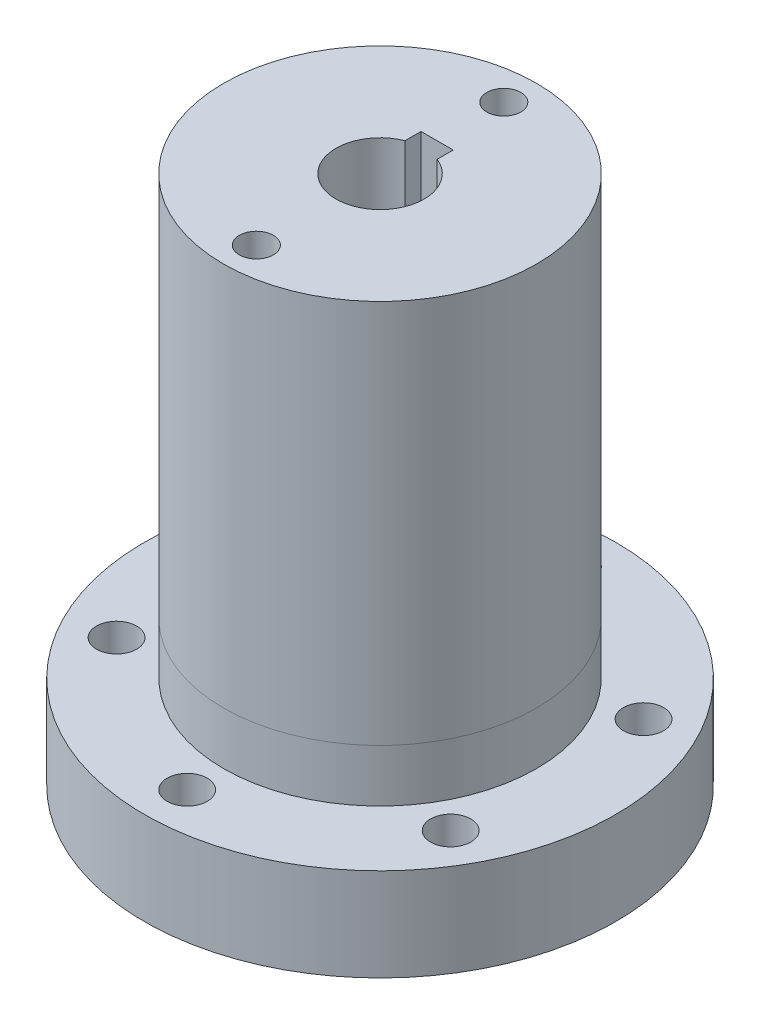
from build123d import *

# Parameters (mm, degrees)
SKETCH1_R           = 25.28
BOSS_EXTRUDE1_DEPTH = 8.5
SKETCH2_R           = 25.3
BOSS_EXTRUDE2_DEPTH = 57.15
SKETCH7_R           = 25.3
BOSS_EXTRUDE4_DEPTH = 15
CUT_EXTRUDE3_DEPTH  = 115
SKETCH6_R           = 38.1
BOSS_EXTRUDE3_DEPTH = 15
SKETCH9_R           = 3.25
CUT_EXTRUDE4_DEPTH  = 20
SKETCH10_R          = 2.75
CUT_EXTRUDE6_DEPTH  = 129
BOSS_EXTRUDE5_START = -93
BOSS_EXTRUDE5_DEPTH = 93
CUT_EXTRUDE8_START  = -10
SKETCH12_R          = 25.3
CUT_EXTRUDE8_DEPTH  = 10
CUT_EXTRUDE9_DEPTH  = 30


with BuildPart() as part:
    # Sketch1 → Boss-Extrude1 (new body)
    with BuildSketch(Plane(origin=(0, 0, 0), x_dir=(1, 0, 0), z_dir=(0, 1, 0))):
        Circle(SKETCH1_R)
    extrude(amount=BOSS_EXTRUDE1_DEPTH)

    # Sketch2 → Boss-Extrude2 (add)
    with BuildSketch(Plane(origin=(0, 8.5, 0), x_dir=(1, 0, 0), z_dir=(0, 1, 0))):
        Circle(SKETCH2_R)
    extrude(amount=BOSS_EXTRUDE2_DEPTH)

    # Sketch7 → Boss-Extrude4 (add)
    with BuildSketch(Plane(origin=(0, 65.65, 0), x_dir=(1, 0, 0), z_dir=(0, 1, 0))):
        Circle(SKETCH7_R)
    extrude(amount=BOSS_EXTRUDE4_DEPTH)

    # Sketch5 → Cut-Extrude3 (cut)
    with BuildSketch(Plane.XZ):
        with BuildLine():
            Line((2.575, 9.15), (-2.575, 9.15))
            Line((-2.575, 9.15), (-2.575, 6.777305881))
            ThreePointArc((-2.575, 6.777305881), (0, -7.25), (2.575, 6.777305881))
            Line((2.575, 6.777305881), (2.575, 9.15))
        make_face()
    extrude(amount=-CUT_EXTRUDE3_DEPTH, mode=Mode.SUBTRACT)

    # Sketch6 → Boss-Extrude3 (add)
    with BuildSketch(Plane.XZ):
        Circle(SKETCH6_R)
    extrude(amount=BOSS_EXTRUDE3_DEPTH)

    # Sketch9 → Cut-Extrude4 (cut)
    with BuildSketch(Plane(origin=(0, 0, 0), x_dir=(1, 0, 0), z_dir=(0, 1, 0))):
        with Locations((0, 31.176914536)):
            Circle(SKETCH9_R)
        with Locations((-27, 15.588457268)):
            Circle(SKETCH9_R)
        with Locations((27, 15.588457268)):
            Circle(SKETCH9_R)
        with Locations((-27, -15.588457268)):
            Circle(SKETCH9_R)
        with Locations((27, -15.588457268)):
            Circle(SKETCH9_R)
        with Locations((0, -31.176914536)):
            Circle(SKETCH9_R)
    extrude(amount=-CUT_EXTRUDE4_DEPTH, mode=Mode.SUBTRACT)

    # Sketch10 → Cut-Extrude6 (cut)
    with BuildSketch(Plane(origin=(0, 80.65, 0), x_dir=(1, 0, 0), z_dir=(0, 1, 0))):
        with Locations((0, 20)):
            Circle(SKETCH10_R)
        with Locations((0, -20)):
            Circle(SKETCH10_R)
    extrude(amount=-CUT_EXTRUDE6_DEPTH, mode=Mode.SUBTRACT)

    # Sketch11 → Boss-Extrude5 (add)
    with BuildSketch(Plane(origin=(0, 80.65, 0), x_dir=(1, 0, 0), z_dir=(0, 1, 0)).offset(BOSS_EXTRUDE5_START)):
        with BuildLine():
            Line((-2.575, -6.777305881), (-2.575, -9.15))
            Line((-2.575, -9.15), (0, -9.15))
            Line((0, -9.15), (2.575, -9.15))
            Line((2.575, -9.15), (2.575, -6.777305881))
            ThreePointArc((2.575, -6.777305881), (0, 7.25), (-2.575, -6.777305881))
        make_face()
    extrude(amount=BOSS_EXTRUDE5_DEPTH)

    # Sketch12 → Cut-Extrude8 (cut)
    with BuildSketch(Plane(origin=(0, 80.65, 0), x_dir=(1, 0, 0), z_dir=(0, 1, 0)).offset(CUT_EXTRUDE8_START)):
        Circle(SKETCH12_R)
    extrude(amount=CUT_EXTRUDE8_DEPTH, mode=Mode.SUBTRACT)

    # Sketch13 → Cut-Extrude9 (cut)
    with BuildSketch(Plane(origin=(0, 70.65, 0), x_dir=(1, 0, 0), z_dir=(0, 1, 0))):
        with BuildLine():
            Line((-2.6, 9.22), (-2.6, 6.62830295))
            ThreePointArc((-2.6, 6.62830295), (0, -7.12), (2.6, 6.62830295))
            Line((2.6, 6.62830295), (2.6, 9.22))
            Line((2.6, 9.22), (-2.6, 9.22))
        make_face()
    extrude(amount=-CUT_EXTRUDE9_DEPTH, mode=Mode.SUBTRACT)


solid = part.part
